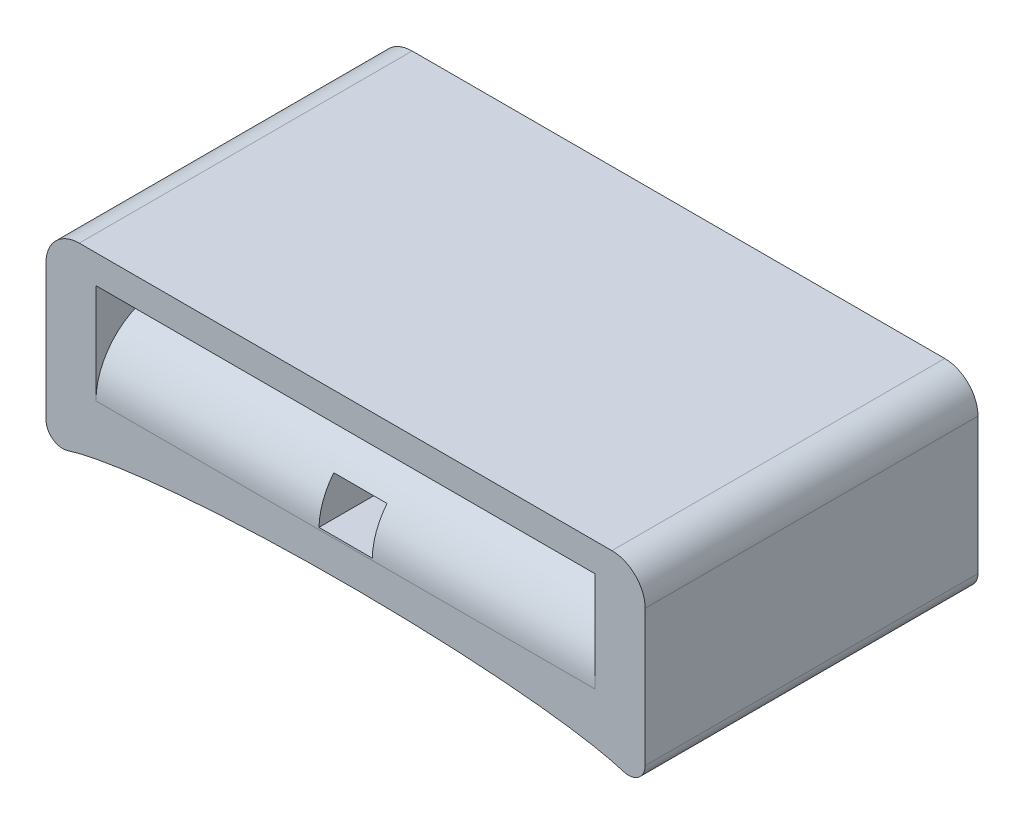
from build123d import *

# Parameters (mm, degrees)
SKETCH1_W           = 9
SKETCH1_H           = 5
BOSS_EXTRUDE1_DEPTH = 3
SKETCH2_RX          = 4.5
SKETCH2_RY          = 0.5727208
CUT_EXTRUDE1_DEPTH  = 10
FILLET1_START       = 30
FILLET1_DEPTH       = 7
CUT_EXTRUDE3_DEPTH  = 10
FILLET2_R           = 0.5
FILLET3_R           = 1


with BuildPart() as part:
    # Sketch1 → Boss-Extrude1 (new body)
    with BuildSketch(Plane(origin=(0, 0, 0), x_dir=(1, 0, 0), z_dir=(0, 1, 0))):
        with Locations((-89.22711343, -33.560593966)):
            Rectangle(SKETCH1_W, SKETCH1_H)
    extrude(amount=BOSS_EXTRUDE1_DEPTH)

    # Sketch2 → Cut-Extrude1 (cut)
    with BuildSketch(Plane.XY.offset(36.060593966)):
        with Locations((-89.22711343, 0)):
            Ellipse(SKETCH2_RX, SKETCH2_RY)
    extrude(amount=-CUT_EXTRUDE1_DEPTH, mode=Mode.SUBTRACT)

    # Fillet1: read off the stored shape, not the designer's step
    # Fillet1 outline → Fillet1 (cut)
    with BuildSketch(Plane.XY.offset(FILLET1_START)):
        with BuildLine():
            ThreePointArc((-84.72711343, 0.452186329), (-84.82937288, 0.250511517), (-85.052495268, 0.213821947))
            add(Edge.make_bspline(
                [(-84.72711343, 0), (-84.72711343, 0.110921166), (-85.052495268, 0.213821947)],
                knots=[0, 0, 0, 0.398284272, 0.398284272, 0.398284272], degree=2, weights=[1, 0.925735272, 0.889131025]))
            Line((-84.72711343, 0), (-84.72711343, 0.452186329))
        make_face()
        with BuildLine():
            ThreePointArc((-93.401731592, 0.213821947), (-93.62485398, 0.250511517), (-93.72711343, 0.452186329))
            Line((-93.72711343, 0.452186329), (-93.72711343, 0))
            add(Edge.make_bspline(
                [(-93.401731592, 0.213821947), (-93.72711343, 0.110921166), (-93.72711343, 0)],
                knots=[2.743308382, 2.743308382, 2.743308382, 3.141592654, 3.141592654, 3.141592654], degree=2, weights=[0.889131025, 0.925735272, 1]))
        make_face()
    extrude(amount=FILLET1_DEPTH, mode=Mode.SUBTRACT)

    # Sketch3 → Cut-Extrude3 (cut)
    with BuildSketch(Plane.XY.offset(36.060593966)):
        Polygon((-85.47711343, 2.0727208), (-85.47711343, 2.5727208), (-92.97711343, 2.5727208), (-92.97711343, 2.0727208), (-89.22711343, 2.0727208), align=None)
        Polygon((-88.82711343, 1.702215796), (-88.82711343, 1.102215796), (-89.62711343, 1.102215796), (-89.62711343, 1.702215796), (-89.22711343, 1.702215796), align=None)
    extrude(amount=-CUT_EXTRUDE3_DEPTH, mode=Mode.SUBTRACT)

    # Fillet2
    fillet2_edges = [part.edges().sort_by_distance(p)[0] for p in [
        (-84.72711343, 3, 33.560593966),
        (-93.72711343, 3, 33.560593966),
    ]]
    fillet(fillet2_edges, radius=FILLET2_R)

    # Fillet3
    # the kernel refuses this fillet: 1 mm, written as the material it takes off along each edge
    with BuildSketch(Plane(origin=(-85.47711343, 2.0727208, 31.060593966), x_dir=(0, -1, 0), z_dir=(-1, 0, 0)), Plane(origin=(-85.47711343, 2.0727208, 36.060593966), x_dir=(0, 0, -1), z_dir=(-1, 0, 0))) as fillet3_piece_1:
        with BuildLine():
            CenterArc((FILLET3_R, FILLET3_R), FILLET3_R, 180, 90)
            Line((0, FILLET3_R), (0, 0))
            Line((0, 0), (FILLET3_R, 0))
        make_face()
    extrude(amount=7.5, mode=Mode.SUBTRACT)


solid = part.part
